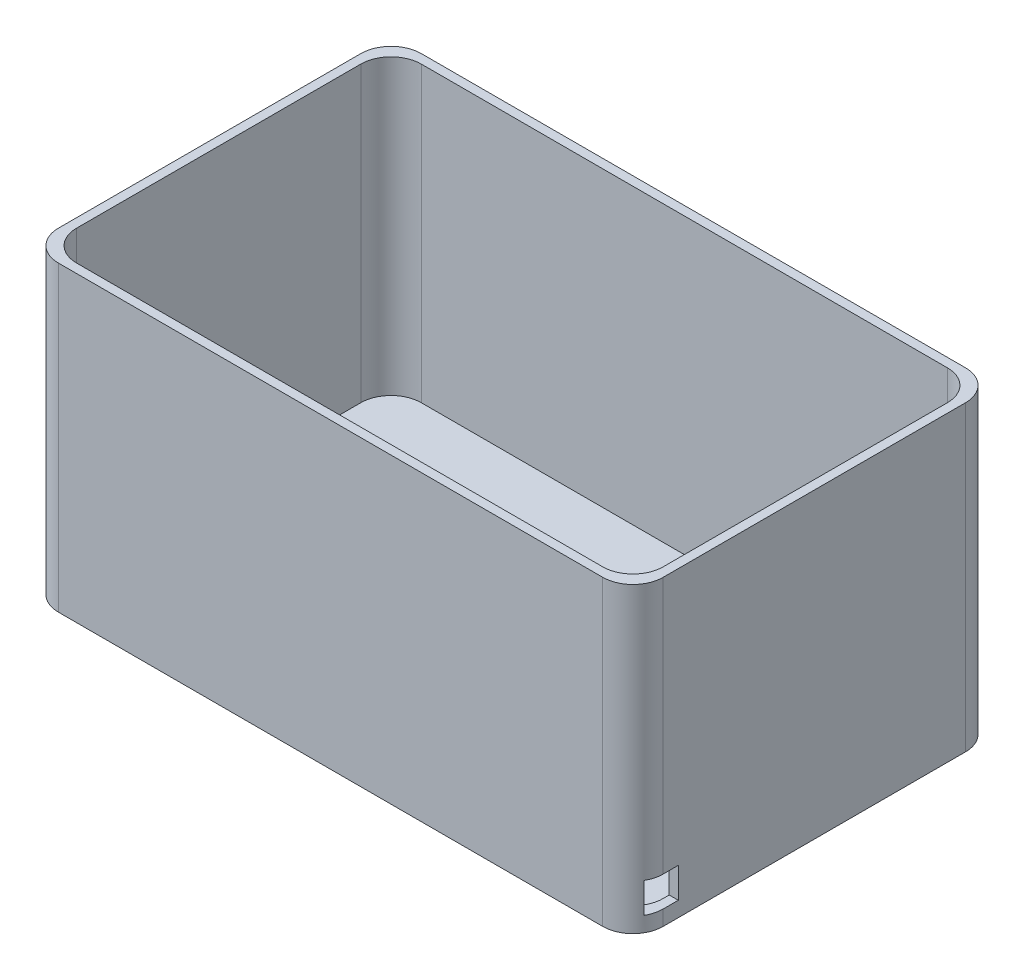
from build123d import *

# Parameters (mm, degrees)
SKETCH1_W                      = 200
SKETCH1_H                      = 120
BOSS_EXTRUDE1_DEPTH            = 100
SHELL1_T                       = -3
CUT_EXTRUDE1_REACH             = 233.517
SKETCH5_W                      = 10
SKETCH5_H                      = 10
CUT_EXTRUDE1_DIRECTION_2_DEPTH = 232.516738056
FILLET2_R                      = 10
FILLET3_R                      = 10


with BuildPart() as part:
    # Sketch1 → Boss-Extrude1 (new body)
    with BuildSketch(Plane(origin=(0, 0, 0), x_dir=(1, 0, 0), z_dir=(0, 1, 0))):
        Rectangle(SKETCH1_W, SKETCH1_H)
    extrude(amount=BOSS_EXTRUDE1_DEPTH)

    # Shell1
    shell1_openings = [part.faces().sort_by_distance(p)[0] for p in [
        (0, 100, 0),
    ]]
    offset(amount=SHELL1_T, openings=shell1_openings, kind=Kind.INTERSECTION)

    # Sketch5 → Cut-Extrude1 (cut, up to next)
    with BuildSketch(Plane(origin=(100, 0, 0), x_dir=(0, 0, -1), z_dir=(1, 0, 0)), mode=Mode.PRIVATE) as cut_extrude1_sk1:
        with Locations((-50, 10)):
            Rectangle(SKETCH5_W, SKETCH5_H)
    cut_extrude1_tool1 = extrude(cut_extrude1_sk1.sketch, amount=-CUT_EXTRUDE1_REACH, mode=Mode.PRIVATE) & part.part
    add(cut_extrude1_tool1.solids().sort_by_distance((100, 10, 50))[0], mode=Mode.SUBTRACT)

    # Sketch5 → Cut-Extrude1 direction 2 (cut)
    with BuildSketch(Plane(origin=(100, 0, 0), x_dir=(0, 0, -1), z_dir=(1, 0, 0))):
        with Locations((-50, 10)):
            Rectangle(SKETCH5_W, SKETCH5_H)
    extrude(amount=CUT_EXTRUDE1_DIRECTION_2_DEPTH, mode=Mode.SUBTRACT)

    # Fillet2
    # the kernel refuses this fillet: 10 mm, written as the material it takes off along each edge
    with BuildSketch(Plane(origin=(-100, -25, -60), x_dir=(1, 0, 0), z_dir=(0, 1, 0)), Plane(origin=(-100, -25, 60), x_dir=(0, 0, -1), z_dir=(0, 1, 0))) as fillet2_piece_1:
        with BuildLine():
            CenterArc((FILLET2_R, -FILLET2_R), FILLET2_R, 90, 90)
            Line((0, -FILLET2_R), (0, 0))
            Line((0, 0), (FILLET2_R, 0))
        make_face()
    extrude(amount=150, mode=Mode.SUBTRACT)
    with BuildSketch(Plane(origin=(100, -25, 60), x_dir=(0, 0, -1), z_dir=(0, 1, 0)), Plane(origin=(100, -25, -60), x_dir=(-1, 0, 0), z_dir=(0, 1, 0))) as fillet2_piece_2:
        with BuildLine():
            CenterArc((FILLET2_R, FILLET2_R), FILLET2_R, 180, 90)
            Line((0, FILLET2_R), (0, 0))
            Line((0, 0), (FILLET2_R, 0))
        make_face()
    extrude(amount=150, mode=Mode.SUBTRACT)

    # Fillet3
    # the kernel refuses this fillet: 10 mm, written as the material it adds along each edge
    with BuildSketch(Plane(origin=(-97, 100, 57), x_dir=(0, 0, -1), z_dir=(0, -1, 0))) as fillet3_piece_1:
        with BuildLine():
            CenterArc((FILLET3_R, FILLET3_R), FILLET3_R, 180, 90)
            Line((0, FILLET3_R), (0, 0))
            Line((0, 0), (FILLET3_R, 0))
        make_face()
    extrude(amount=97)
    with BuildSketch(Plane(origin=(97, 100, 57), x_dir=(0, 0, -1), z_dir=(0, -1, 0))) as fillet3_piece_2_section:
        with BuildLine():
            CenterArc((FILLET3_R, -FILLET3_R), FILLET3_R, 90, 90)
            Line((0, -FILLET3_R), (0, 0))
            Line((0, 0), (FILLET3_R, 0))
        make_face()
    fillet3_piece_2 = extrude(amount=97, mode=Mode.PRIVATE)
    fillet3_piece_2 = split(fillet3_piece_2, bisect_by=Plane(origin=(96.033482281, 15, 52.791302356), z_dir=(0, 1, 0)), keep=Keep.TOP, mode=Mode.PRIVATE)
    fillet3_piece_2 = split(fillet3_piece_2, bisect_by=Plane(origin=(96.033482281, 57.5, 55), z_dir=(0, 0, -1)), keep=Keep.TOP, mode=Mode.PRIVATE)
    add(fillet3_piece_2)
    with BuildSketch(Plane(origin=(97, 100, 57), x_dir=(0, 0, -1), z_dir=(0, -1, 0))) as fillet3_piece_3_section:
        with BuildLine():
            CenterArc((FILLET3_R, -FILLET3_R), FILLET3_R, 90, 90)
            Line((0, -FILLET3_R), (0, 0))
            Line((0, 0), (FILLET3_R, 0))
        make_face()
    fillet3_piece_3 = extrude(amount=97, mode=Mode.PRIVATE)
    fillet3_piece_3 = split(fillet3_piece_3, bisect_by=Plane(origin=(93.714174943, 15, 56.26775421), z_dir=(0, 1, 0)), keep=Keep.TOP, mode=Mode.PRIVATE)
    fillet3_piece_3 = split(fillet3_piece_3, bisect_by=Plane(origin=(93.714174943, 57.5, 55), z_dir=(0, 0, 1)), keep=Keep.TOP, mode=Mode.PRIVATE)
    add(fillet3_piece_3)
    with BuildSketch(Plane(origin=(97, 100, 57), x_dir=(0, 0, -1), z_dir=(0, -1, 0))) as fillet3_piece_4_section:
        with BuildLine():
            CenterArc((FILLET3_R, -FILLET3_R), FILLET3_R, 90, 90)
            Line((0, -FILLET3_R), (0, 0))
            Line((0, 0), (FILLET3_R, 0))
        make_face()
    fillet3_piece_4 = extrude(amount=97, mode=Mode.PRIVATE)
    fillet3_piece_4 = split(fillet3_piece_4, bisect_by=Plane(origin=(93.714174943, 15, 56.26775421), z_dir=(0, -1, 0)), keep=Keep.TOP, mode=Mode.PRIVATE)
    fillet3_piece_4 = split(fillet3_piece_4, bisect_by=Plane(origin=(93.714174943, 10, 55), z_dir=(0, 0, 1)), keep=Keep.TOP, mode=Mode.PRIVATE)
    fillet3_piece_4 = split(fillet3_piece_4, bisect_by=Plane(origin=(93.714174943, 5, 56.26775421), z_dir=(0, 1, 0)), keep=Keep.TOP, mode=Mode.PRIVATE)
    add(fillet3_piece_4)
    with BuildSketch(Plane(origin=(97, 100, 57), x_dir=(0, 0, -1), z_dir=(0, -1, 0))) as fillet3_piece_5_section:
        with BuildLine():
            CenterArc((FILLET3_R, -FILLET3_R), FILLET3_R, 90, 90)
            Line((0, -FILLET3_R), (0, 0))
            Line((0, 0), (FILLET3_R, 0))
        make_face()
    fillet3_piece_5 = extrude(amount=97, mode=Mode.PRIVATE)
    fillet3_piece_5 = split(fillet3_piece_5, bisect_by=Plane(origin=(96.033482281, 4, 55), z_dir=(0, 0, -1)), keep=Keep.TOP, mode=Mode.PRIVATE)
    fillet3_piece_5 = split(fillet3_piece_5, bisect_by=Plane(origin=(96.033482281, 5, 52.791302356), z_dir=(0, -1, 0)), keep=Keep.TOP, mode=Mode.PRIVATE)
    add(fillet3_piece_5)
    with BuildSketch(Plane(origin=(97, 100, 57), x_dir=(0, 0, -1), z_dir=(0, -1, 0))) as fillet3_piece_6_section:
        with BuildLine():
            CenterArc((FILLET3_R, -FILLET3_R), FILLET3_R, 90, 90)
            Line((0, -FILLET3_R), (0, 0))
            Line((0, 0), (FILLET3_R, 0))
        make_face()
    fillet3_piece_6 = extrude(amount=97, mode=Mode.PRIVATE)
    fillet3_piece_6 = split(fillet3_piece_6, bisect_by=Plane(origin=(93.714174943, 4, 55), z_dir=(0, 0, 1)), keep=Keep.TOP, mode=Mode.PRIVATE)
    fillet3_piece_6 = split(fillet3_piece_6, bisect_by=Plane(origin=(93.714174943, 5, 56.26775421), z_dir=(0, -1, 0)), keep=Keep.TOP, mode=Mode.PRIVATE)
    add(fillet3_piece_6)
    with BuildSketch(Plane(origin=(-97, 3, -57), x_dir=(1, 0, 0), z_dir=(0, 1, 0)), Plane(origin=(97, 100, -57), x_dir=(-1, 0, 0), z_dir=(0, -1, 0))) as fillet3_piece_7:
        with BuildLine():
            CenterArc((FILLET3_R, -FILLET3_R), FILLET3_R, 90, 90)
            Line((0, -FILLET3_R), (0, 0))
            Line((0, 0), (FILLET3_R, 0))
        make_face()
    extrude(amount=97)


solid = part.part
